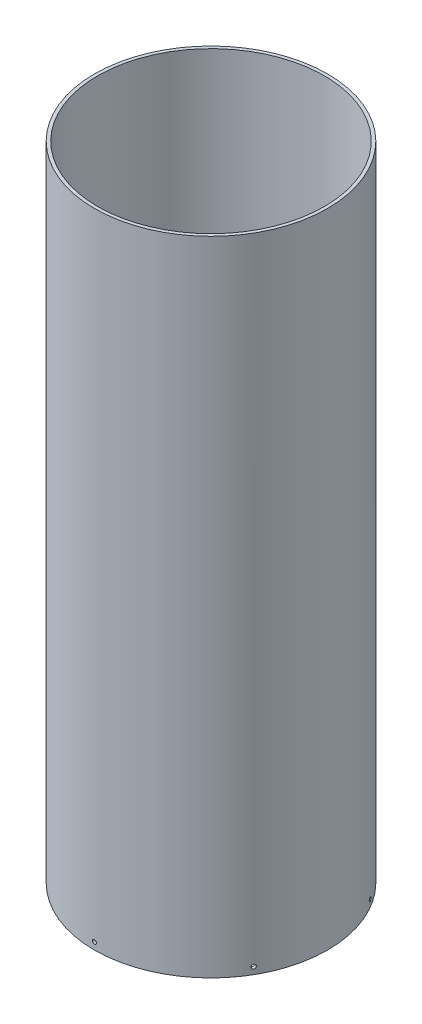
from build123d import *

# Parameters (mm, degrees)
SKETCH1_R           = 78.359
SKETCH1_R_2         = 76.2
BOSS_EXTRUDE1_DEPTH = 431.8
SKETCH2_R           = 1.35255
CUT_EXTRUDE1_DEPTH  = 446.793119913
CIRPATTERN1_COUNT   = 6


with BuildPart() as part:
    # Sketch1 → Boss-Extrude1 (new body)
    with BuildSketch(Plane(origin=(0, 0, 0), x_dir=(1, 0, 0), z_dir=(0, 1, 0))):
        Circle(SKETCH1_R)
        Circle(SKETCH1_R_2, mode=Mode.SUBTRACT)
    extrude(amount=BOSS_EXTRUDE1_DEPTH)

    # Sketch2 → Cut-Extrude1 (cut, through all)
    with BuildSketch(Plane.XY):
        with Locations((0, 4.7625)):
            Circle(SKETCH2_R)
    cut_extrude1 = extrude(amount=-CUT_EXTRUDE1_DEPTH, mode=Mode.SUBTRACT)

    # CirPattern1: Cut-Extrude1 ×6 about axis
    cirpattern1_axis = Axis((0, 431.8, 0), (0, -1, 0))
    for i in range(1, CIRPATTERN1_COUNT):
        add(cut_extrude1.rotate(cirpattern1_axis, i * 360 / CIRPATTERN1_COUNT), mode=Mode.SUBTRACT)


solid = part.part
